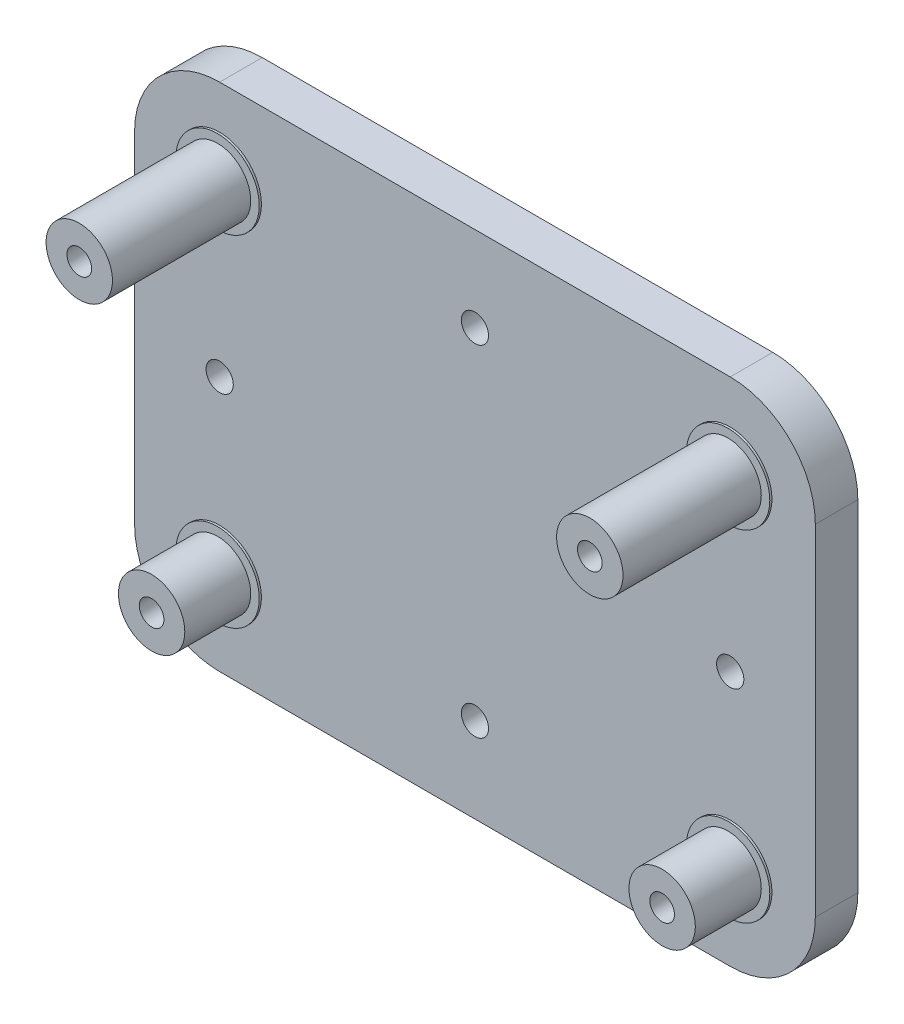
from build123d import *

# Parameters (mm, degrees)
SKETCH1_W               = 80
SKETCH1_H               = 60
BOSS_EXTRUDE1_DEPTH     = 5
SKETCH1_3_R             = 3.9
SKETCH1_3_R_2           = 1.45
BOSS_EXTRUDE2_DEPTH     = 8
SKETCH1_5_R             = 3.9
SKETCH1_5_R_2           = 1.45
BOSS_EXTRUDE4_DEPTH     = 16.5
SKETCH1_4_R             = 4.9
SKETCH1_4_R_2           = 3.9
BOSS_EXTRUDE3_DEPTH     = 0.25
CUT_EXTRUDE1_DEPTH      = 53.65216045
CUT_EXTRUDE1_DEPTH_BACK = 53.65216045
SKETCH1_6_R             = 1.6
FILLET1_R               = 10


with BuildPart() as part:
    # Sketch1 → Boss-Extrude1 (new body)
    with BuildSketch(Plane.XY):
        Rectangle(SKETCH1_W, SKETCH1_H)
    extrude(amount=-BOSS_EXTRUDE1_DEPTH)

    # Sketch1<3> → Boss-Extrude2 (add)
    # profile 1 of 2: a face of its own
    with BuildSketch(Plane.XY):
        with Locations((-30, -20)):
            Circle(SKETCH1_3_R)
        with Locations((-30, -20)):
            Circle(SKETCH1_3_R_2, mode=Mode.SUBTRACT)
    # profile 2 of 2: a face of its own
    with BuildSketch(Plane.XY):
        with Locations((30, -20)):
            Circle(SKETCH1_3_R)
        with Locations((30, -20)):
            Circle(SKETCH1_3_R_2, mode=Mode.SUBTRACT)
    extrude(amount=BOSS_EXTRUDE2_DEPTH)

    # Sketch1<5> → Boss-Extrude4 (add)
    # profile 1 of 2: a face of its own
    with BuildSketch(Plane.XY):
        with Locations((-30, 20)):
            Circle(SKETCH1_5_R)
        with Locations((-30, 20)):
            Circle(SKETCH1_5_R_2, mode=Mode.SUBTRACT)
    # profile 2 of 2: a face of its own
    with BuildSketch(Plane.XY):
        with Locations((30, 20)):
            Circle(SKETCH1_5_R)
        with Locations((30, 20)):
            Circle(SKETCH1_5_R_2, mode=Mode.SUBTRACT)
    extrude(amount=BOSS_EXTRUDE4_DEPTH)

    # Sketch1<4> → Boss-Extrude3 (add)
    # profile 1 of 4: a face of its own
    with BuildSketch(Plane.XY):
        with Locations((-30, 20)):
            Circle(SKETCH1_4_R)
        with Locations((-30, 20)):
            Circle(SKETCH1_4_R_2, mode=Mode.SUBTRACT)
    # profile 2 of 4: a face of its own
    with BuildSketch(Plane.XY):
        with Locations((30, 20)):
            Circle(SKETCH1_4_R)
        with Locations((30, 20)):
            Circle(SKETCH1_4_R_2, mode=Mode.SUBTRACT)
    # profile 3 of 4: a face of its own
    with BuildSketch(Plane.XY):
        with Locations((30, -20)):
            Circle(SKETCH1_4_R)
        with Locations((30, -20)):
            Circle(SKETCH1_4_R_2, mode=Mode.SUBTRACT)
    # profile 4 of 4: a face of its own
    with BuildSketch(Plane.XY):
        with Locations((-30, -20)):
            Circle(SKETCH1_4_R)
        with Locations((-30, -20)):
            Circle(SKETCH1_4_R_2, mode=Mode.SUBTRACT)
    extrude(amount=BOSS_EXTRUDE3_DEPTH)

    # Sketch1<6> → Cut-Extrude1 (cut, two sides: drawn at the far end of the back side and taken through both)
    with BuildSketch(Plane.XY.offset(-CUT_EXTRUDE1_DEPTH_BACK)):
        with Locations((-30, 0)):
            Circle(SKETCH1_6_R)
        with Locations((0, 20)):
            Circle(SKETCH1_6_R)
        with Locations((30, 0)):
            Circle(SKETCH1_6_R)
        with Locations((0, -20)):
            Circle(SKETCH1_6_R)
    extrude(amount=CUT_EXTRUDE1_DEPTH + CUT_EXTRUDE1_DEPTH_BACK, mode=Mode.SUBTRACT)

    # Fillet1
    fillet1_edges = [part.edges().sort_by_distance(p)[0] for p in [
        (40, 30, -2.5),
        (40, -30, -2.5),
        (-40, -30, -2.5),
        (-40, 30, -2.5),
    ]]
    fillet(fillet1_edges, radius=FILLET1_R)


solid = part.part
